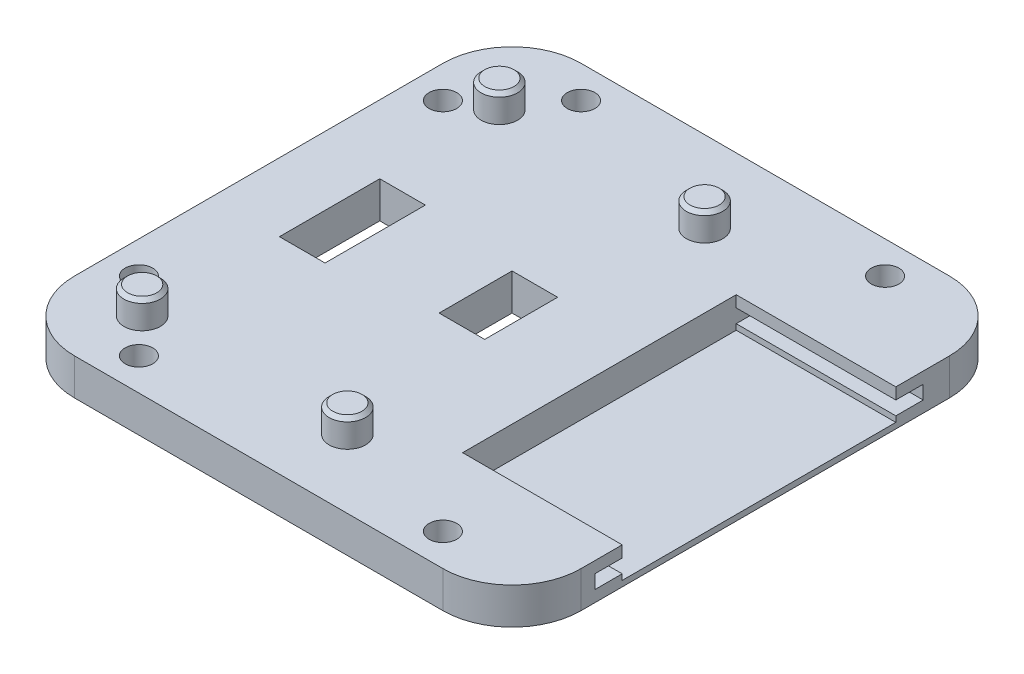
from build123d import *

# Parameters (mm, degrees)
SKETCH1_R                = 3.030073628
SKETCH1_W                = 10
SKETCH1_H                = 22
SKETCH1_H_2              = 16
BOSS_EXTRUDE1_DEPTH      = 8
CUT_EXTRUDE1_DEPTH       = 35
SKETCH4_R                = 4
BOSS_EXTRUDE2_DEPTH      = 6
CHAMFER1_SIZE            = 0.8
CHAMFER1_OF_MIRROR1_SIZE = 0.8


with BuildPart() as part:
    # Sketch1 → Boss-Extrude1 (new body)
    with BuildSketch(Plane(origin=(0, 0, 0), x_dir=(1, 0, 0), z_dir=(0, 1, 0))):
        with BuildLine():
            Line((40.023322568, 56.936099997), (-40.778640835, 56.936099997))
            ThreePointArc((-40.778640835, 56.936099997), (-51.491568883, 52.498659907), (-55.929008973, 41.785731859))
            Line((-55.929008973, 41.785731859), (-55.929008973, -39.016231544))
            ThreePointArc((-55.929008973, -39.016231544), (-51.491568883, -49.729159592), (-40.778640835, -54.166599682))
            Line((-40.778640835, -54.166599682), (40.023322568, -54.166599682))
            ThreePointArc((40.023322568, -54.166599682), (50.736250615, -49.729159592), (55.173690706, -39.016231544))
            Line((55.173690706, -39.016231544), (55.173690706, 41.785731859))
            ThreePointArc((55.173690706, 41.785731859), (50.736250615, 52.498659907), (40.023322568, 56.936099997))
        make_face()
        with Locations((-48.858837176, 34.715560061)):
            Circle(SKETCH1_R, mode=Mode.SUBTRACT)
        with Locations((-33.708469038, 49.865928199)):
            Circle(SKETCH1_R, mode=Mode.SUBTRACT)
        with Locations((32.95315077, 49.865928199)):
            Circle(SKETCH1_R, mode=Mode.SUBTRACT)
        with Locations((-48.858837176, -31.946059746)):
            Circle(SKETCH1_R, mode=Mode.SUBTRACT)
        with Locations((-33.708469038, -47.096427884)):
            Circle(SKETCH1_R, mode=Mode.SUBTRACT)
        with Locations((32.95315077, -47.096427884)):
            Circle(SKETCH1_R, mode=Mode.SUBTRACT)
        with Locations((-35.929008973, 1.936099997)):
            Rectangle(SKETCH1_W, SKETCH1_H, mode=Mode.SUBTRACT)
        with Locations((-3.918365064, 1.936099997)):
            Rectangle(SKETCH1_W, SKETCH1_H_2, mode=Mode.SUBTRACT)
    extrude(amount=BOSS_EXTRUDE1_DEPTH)

    # Sketch3 → Cut-Extrude1 (cut)
    with BuildSketch(Plane(origin=(55.173690706, 0, 0), x_dir=(0, 0, -1), z_dir=(1, 0, 0))):
        Polygon((-30, 8), (-30, 5.5), (-36, 5.5), (-36, 2.5), (-30, 2.5), (-30, 1.25), (30, 1.25), (30, 2.5), (36, 2.5), (36, 5.5), (30, 5.5), (30, 8), align=None)
    extrude(amount=-CUT_EXTRUDE1_DEPTH, mode=Mode.SUBTRACT)

    # Sketch4 → Boss-Extrude2 (add)
    with BuildSketch(Plane(origin=(0, 8, 0), x_dir=(1, 0, 0), z_dir=(0, 1, 0))):
        with Locations((4.070991027, -39.166599682)):
            Circle(SKETCH4_R)
        with Locations((-40.929008973, -39.166599682)):
            Circle(SKETCH4_R)
    boss_extrude2 = extrude(amount=BOSS_EXTRUDE2_DEPTH)

    # Chamfer1
    chamfer1_edges = [part.edges().sort_by_distance(p)[0] for p in [
        (0.070991027, 14, 39.166599682),
        (-44.929008973, 14, 39.166599682),
    ]]
    chamfer(chamfer1_edges, length=CHAMFER1_SIZE)

    # Mirror1: Boss-Extrude2 across plane
    add(boss_extrude2.mirror(Plane.XY))

    # Chamfer1 of Mirror1
    chamfer1_of_mirror1_edges = [part.edges().sort_by_distance(p)[0] for p in [
        (0.070991027, 14, -39.166599682),
        (-44.929008973, 14, -39.166599682),
    ]]
    chamfer(chamfer1_of_mirror1_edges, length=CHAMFER1_OF_MIRROR1_SIZE)


solid = part.part
